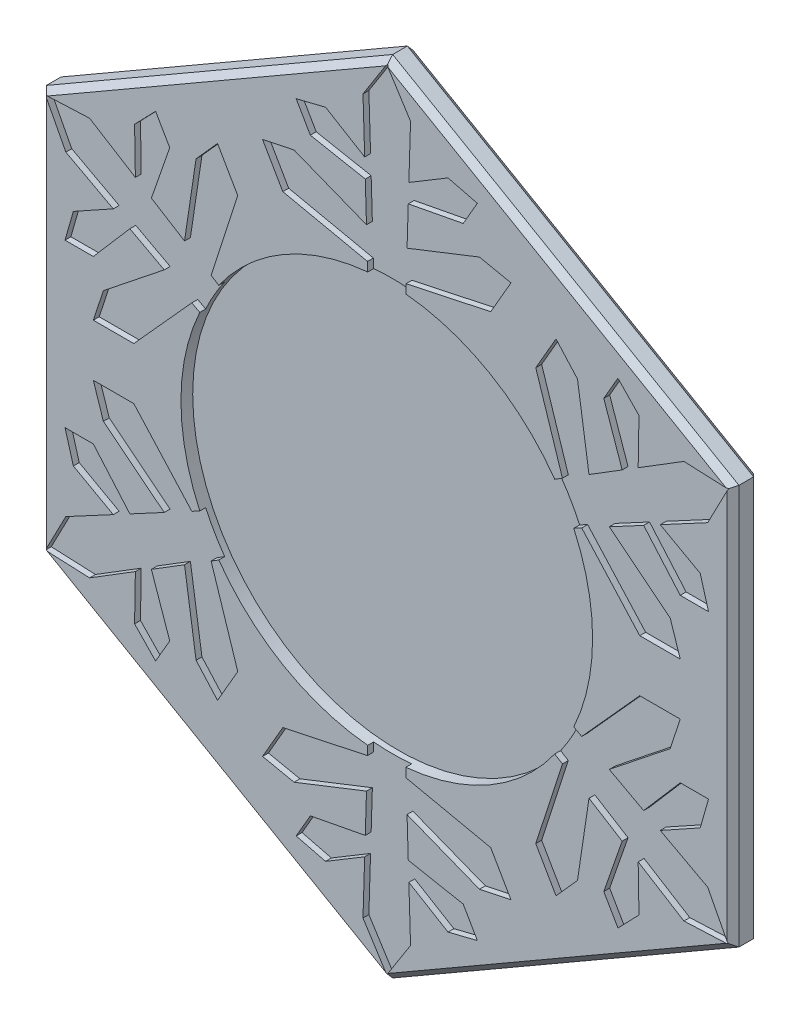
from build123d import *

# Parameters (mm, degrees)
EXTRUDE_1_DEPTH          = 5.5
CUT_EXTRUDE_8_DEPTH      = 1
SKETCH_7_R               = 37.5
CUT_EXTRUDE_9_DEPTH      = 1
SKETCH_8_R               = 35
CUT_EXTRUDE_10_DEPTH     = 2
CHAMFER_1_SIZE           = 1
CUT_EXTRUDE_START        = -2
SKETCH_10_R              = 35
CUT_EXTRUDE_11_DEPTH     = 2
EXTRUDE_START            = 1
EXTRUDE_2_DEPTH          = 1
PATTERN_CIRCULAR_1_COUNT = 6


with BuildPart() as part:
    # 스케치1 → 보스-돌출1 (new body)
    with BuildSketch(Plane.XY):
        Polygon((58.889727457, -34), (58.889727457, 34), (0, 68), (-58.889727457, 34), (-58.889727457, -34), (0, -68), align=None)
    extrude(amount=EXTRUDE_1_DEPTH)

    # 스케치6 → 컷-돌출8 (cut)
    with BuildSketch(Plane.XY.offset(5.5)):
        Polygon((-33.152687653, -15.35134242), (-27.3129803, -12.219678275), (-30.956617742, -8.576040833), (-32.161108524, -3.806551313), (-26.774618061, -3.806551313), (-23.390854065, -10.116356763), (-18.086111175, -7.271578403), (-19.979907887, -3.7401593), (-21.080522468, -5.792508073), (-24.19602311, -4.12175626), (-21.985645858, 0), (-24.19602311, 4.12175626), (-21.080522468, 5.792508073), (-19.979907887, 3.7401593), (-18.086111175, 7.271578403), (-23.390854065, 10.116356763), (-26.774618061, 3.806551313), (-32.161108524, 3.806551313), (-30.956617742, 8.576040833), (-27.3129803, 12.219678275), (-33.152687653, 15.35134242), (-43.016050627, 4.421097845), (-49.901643463, 4.421097845), (-48.193945113, 9.621970914), (-37.838156141, 17.864022042), (-43.683392033, 20.99865098), (-49.901643463, 13.801443509), (-54.714608607, 13.801443509), (-53.296688501, 18.748031205), (-46.506598426, 22.512653943), (-54.573925242, 26.838925211), (-58.05155344, 33.516080006), (-50.530153664, 33.842943038), (-42.749829434, 29.019568709), (-42.884615545, 36.782270577), (-39.309704991, 40.483519257), (-36.903222419, 36.315369176), (-40.027061211, 27.331601734), (-34.389774972, 23.836793429), (-32.429843803, 36.92619532), (-28.779604778, 41.005542007), (-25.33680836, 35.042443691), (-29.870996345, 21.035398501), (-24.239041963, 17.543895655), (-22.905378096, 22.521196964), (-19.3771244, 25.949061339), (-16.683879168, 21.284223761), (-20.456448983, 15.198895455), (-15.34042721, 12.027242531), (-13.229026912, 15.433028145), (-15.556720377, 15.360013946), (-15.667557184, 18.893492554), (-10.992822929, 19.040127831), (-8.528465926, 23.015248813), (-5.523802091, 21.152522019), (-6.750880975, 19.173187445), (-2.745683965, 19.298820935), (-2.934405082, 25.315252218), (-10.090738893, 25.090775074), (-12.783984124, 29.755612652), (-8.051239646, 31.097237797), (-3.073938337, 29.763573931), (-3.281691308, 36.386740922), (-17.679242267, 39.463541536), (-21.122038685, 45.426639853), (-15.764101311, 46.548166234), (-3.448381168, 41.700815471), (-3.656330822, 48.330252714), (-12.998421044, 50.116812684), (-15.404903616, 54.284962766), (-10.412072957, 55.530301782), (-3.756768991, 51.532222652), (-4.043771578, 60.681868249), (0, 67.032160011), (4.043771578, 60.681868249), (3.756768991, 51.532222652), (10.412072957, 55.530301782), (15.404903616, 54.284962766), (12.998421044, 50.116812684), (3.656330822, 48.330252714), (3.448381168, 41.700815471), (15.764101311, 46.548166234), (21.122038685, 45.426639853), (17.679242267, 39.463541536), (3.281691308, 36.386740922), (3.073938337, 29.763573931), (8.051239646, 31.097237797), (12.783984124, 29.755612652), (10.090738893, 25.090775074), (2.934405082, 25.315252218), (2.745683965, 19.298820935), (6.750880975, 19.173187445), (5.523802091, 21.152522019), (8.528465926, 23.015248813), (10.992822929, 19.040127831), (15.667557184, 18.893492554), (15.556720377, 15.360013946), (13.229026912, 15.433028145), (15.34042721, 12.027242531), (20.456448983, 15.198895455), (16.683879168, 21.284223761), (19.3771244, 25.949061339), (22.905378096, 22.521196964), (24.239041963, 17.543895655), (29.870996345, 21.035398501), (25.33680836, 35.042443691), (28.779604778, 41.005542007), (32.429843803, 36.92619532), (34.389774972, 23.836793429), (40.027061211, 27.331601734), (36.903222419, 36.315369176), (39.309704991, 40.483519257), (42.884615545, 36.782270577), (42.749829434, 29.019568709), (50.530153664, 33.842943038), (58.05155344, 33.516080006), (54.573925242, 26.838925211), (46.506598426, 22.512653943), (53.296688501, 18.748031205), (54.714608607, 13.801443509), (49.901643463, 13.801443509), (43.683392033, 20.99865098), (37.838156141, 17.864022042), (48.193945113, 9.621970914), (49.901643463, 4.421097845), (43.016050627, 4.421097845), (33.152687653, 15.35134242), (27.3129803, 12.219678275), (30.956617742, 8.576040833), (32.161108524, 3.806551313), (26.774618061, 3.806551313), (23.390854065, 10.116356763), (18.086111175, 7.271578403), (19.979907887, 3.7401593), (21.080522468, 5.792508073), (24.19602311, 4.12175626), (21.985645858, 0), (24.19602311, -4.12175626), (21.080522468, -5.792508073), (19.979907887, -3.7401593), (18.086111175, -7.271578403), (23.390854065, -10.116356763), (26.774618061, -3.806551313), (32.161108524, -3.806551313), (30.956617742, -8.576040833), (27.3129803, -12.219678275), (33.152687653, -15.35134242), (43.016050627, -4.421097845), (49.901643463, -4.421097845), (48.193945113, -9.621970914), (37.838156141, -17.864022042), (43.683392033, -20.99865098), (49.901643463, -13.801443509), (54.714608607, -13.801443509), (53.296688501, -18.748031205), (46.506598426, -22.512653943), (54.573925242, -26.838925211), (58.05155344, -33.516080006), (50.530153664, -33.842943038), (42.749829434, -29.019568709), (42.884615545, -36.782270577), (39.309704991, -40.483519257), (36.903222419, -36.315369176), (40.027061211, -27.331601734), (34.389774972, -23.836793429), (32.429843803, -36.92619532), (28.779604778, -41.005542007), (25.33680836, -35.042443691), (29.870996345, -21.035398501), (24.239041963, -17.543895655), (22.905378096, -22.521196964), (19.3771244, -25.949061339), (16.683879168, -21.284223761), (20.456448983, -15.198895455), (15.34042721, -12.027242531), (13.229026912, -15.433028145), (15.556720377, -15.360013946), (15.667557184, -18.893492554), (10.992822929, -19.040127831), (8.528465926, -23.015248813), (5.523802091, -21.152522019), (6.750880975, -19.173187445), (2.745683965, -19.298820935), (3.281691308, -36.386740922), (17.679242267, -39.463541536), (21.122038685, -45.426639853), (15.764101311, -46.548166234), (3.448381168, -41.700815471), (3.656330822, -48.330252714), (12.998421044, -50.116812684), (15.404903616, -54.284962766), (10.412072957, -55.530301782), (3.756768991, -51.532222652), (4.043771578, -60.681868249), (0, -67.032160011), (-4.043771578, -60.681868249), (-3.756768991, -51.532222652), (-10.412072957, -55.530301782), (-15.404903616, -54.284962766), (-12.998421044, -50.116812684), (-3.656330822, -48.330252714), (-3.448381168, -41.700815471), (-15.764101311, -46.548166234), (-21.122038685, -45.426639853), (-17.679242267, -39.463541536), (-3.281691308, -36.386740922), (-2.745683965, -19.298820935), (-6.750880975, -19.173187445), (-5.523802091, -21.152522019), (-8.528465926, -23.015248813), (-10.992822929, -19.040127831), (-15.667557184, -18.893492554), (-15.556720377, -15.360013946), (-13.229026912, -15.433028145), (-15.34042721, -12.027242531), (-20.456448983, -15.198895455), (-16.683879168, -21.284223761), (-19.3771244, -25.949061339), (-22.905378096, -22.521196964), (-24.239041963, -17.543895655), (-29.870996345, -21.035398501), (-25.33680836, -35.042443691), (-28.779604778, -41.005542007), (-32.429843803, -36.92619532), (-34.389774972, -23.836793429), (-40.027061211, -27.331601734), (-36.903222419, -36.315369176), (-39.309704991, -40.483519257), (-42.884615545, -36.782270577), (-42.749829434, -29.019568709), (-50.530153664, -33.842943038), (-58.05155344, -33.516080006), (-54.573925242, -26.838925211), (-46.506598426, -22.512653943), (-53.296688501, -18.748031205), (-54.714608607, -13.801443509), (-49.901643463, -13.801443509), (-43.683392033, -20.99865098), (-37.838156141, -17.864022042), (-48.193945113, -9.621970914), (-49.901643463, -4.421097845), (-43.016050627, -4.421097845), align=None)
        Polygon((-11.624772014, -3.806551313), (-14.970610533, 0), (-11.624772014, 3.806551313), (-14.970610533, 5.600826589), (-17.974169916, 0), (-14.970610533, -5.600826589), align=None, mode=Mode.SUBTRACT)
        Polygon((8.987084958, -15.566087759), (12.335763375, -10.164515737), (9.108956144, -8.164072221), (7.485305267, -12.964929032), (2.515815869, -11.970623533), (2.634847158, -15.765342327), align=None, mode=Mode.SUBTRACT)
        with BuildLine():
            Line((-12.195196565, 0), (-9.738486924, -2.794991825))
            Line((-9.738486924, -2.794991825), (-5.95116479, -0.763961806))
            ThreePointArc((-5.95116479, -0.763961806), (-6, 0), (-5.95116479, 0.763961806))
            Line((-5.95116479, 0.763961806), (-9.738486924, 2.794991825))
            Line((-9.738486924, 2.794991825), (-12.195196565, 0))
        make_face(mode=Mode.SUBTRACT)
        with BuildLine():
            Line((-6.097598283, -10.56135003), (-7.289777385, -7.036281158))
            Line((-7.289777385, -7.036281158), (-3.637192727, -4.771878987))
            ThreePointArc((-3.637192727, -4.771878987), (-3, -5.196152423), (-2.313972063, -5.535840793))
            Line((-2.313972063, -5.535840793), (-2.448709539, -9.831272983))
            Line((-2.448709539, -9.831272983), (-6.097598283, -10.56135003))
        make_face(mode=Mode.SUBTRACT)
        Polygon((-9.108956144, -8.164072221), (-7.485305267, -12.964929032), (-2.515815869, -11.970623533), (-2.634847158, -15.765342327), (-8.987084958, -15.566087759), (-12.335763375, -10.164515737), align=None, mode=Mode.SUBTRACT)
        Polygon((-9.108956144, 8.164072221), (-7.485305267, 12.964929032), (-2.515815869, 11.970623533), (-2.634847158, 15.765342327), (-8.987084958, 15.566087759), (-12.335763375, 10.164515737), align=None, mode=Mode.SUBTRACT)
        with BuildLine():
            Line((-6.097598283, 10.56135003), (-7.289777385, 7.036281158))
            Line((-7.289777385, 7.036281158), (-3.637192727, 4.771878987))
            ThreePointArc((-3.637192727, 4.771878987), (-3, 5.196152423), (-2.313972063, 5.535840793))
            Line((-2.313972063, 5.535840793), (-2.448709539, 9.831272983))
            Line((-2.448709539, 9.831272983), (-6.097598283, 10.56135003))
        make_face(mode=Mode.SUBTRACT)
        Polygon((2.515815869, 11.970623533), (7.485305267, 12.964929032), (9.108956144, 8.164072221), (12.335763375, 10.164515737), (8.987084958, 15.566087759), (2.634847158, 15.765342327), align=None, mode=Mode.SUBTRACT)
        with BuildLine():
            Line((6.097598283, 10.56135003), (2.448709539, 9.831272983))
            Line((2.448709539, 9.831272983), (2.313972063, 5.535840793))
            ThreePointArc((2.313972063, 5.535840793), (3, 5.196152423), (3.637192727, 4.771878987))
            Line((3.637192727, 4.771878987), (7.289777385, 7.036281158))
            Line((7.289777385, 7.036281158), (6.097598283, 10.56135003))
        make_face(mode=Mode.SUBTRACT)
        Polygon((11.624772014, 3.806551313), (14.970610533, 0), (11.624772014, -3.806551313), (14.970610533, -5.600826589), (17.974169916, 0), (14.970610533, 5.600826589), align=None, mode=Mode.SUBTRACT)
        with BuildLine():
            Line((12.195196565, 0), (9.738486924, 2.794991825))
            Line((9.738486924, 2.794991825), (5.95116479, 0.763961806))
            ThreePointArc((5.95116479, 0.763961806), (6, 0), (5.95116479, -0.763961806))
            Line((5.95116479, -0.763961806), (9.738486924, -2.794991825))
            Line((9.738486924, -2.794991825), (12.195196565, 0))
        make_face(mode=Mode.SUBTRACT)
        with BuildLine():
            Line((6.097598283, -10.56135003), (7.289777385, -7.036281158))
            Line((7.289777385, -7.036281158), (3.637192727, -4.771878987))
            ThreePointArc((3.637192727, -4.771878987), (3, -5.196152423), (2.313972063, -5.535840793))
            Line((2.313972063, -5.535840793), (2.448709539, -9.831272983))
            Line((2.448709539, -9.831272983), (6.097598283, -10.56135003))
        make_face(mode=Mode.SUBTRACT)
    extrude(amount=-CUT_EXTRUDE_8_DEPTH, mode=Mode.SUBTRACT)

    # 스케치7 → 컷-돌출9 (cut)
    with BuildSketch(Plane(origin=(0, 0, 0), x_dir=(-1, 0, 0), z_dir=(0, 0, -1))):
        Polygon((0, 68), (-58.889727457, 34), (-58.889727457, -34), (0, -68), (58.889727457, -34), (58.889727457, 34), align=None)
        Circle(SKETCH_7_R, mode=Mode.SUBTRACT)
    extrude(amount=-CUT_EXTRUDE_9_DEPTH, mode=Mode.SUBTRACT)

    # 스케치8 → 컷-돌출10 (cut)
    with BuildSketch(Plane(origin=(0, 0, 0), x_dir=(-1, 0, 0), z_dir=(0, 0, -1))):
        Circle(SKETCH_8_R)
    extrude(amount=-CUT_EXTRUDE_10_DEPTH, mode=Mode.SUBTRACT)

    # 모따기1
    # the kernel refuses this chamfer: 1 mm, written as the material it takes off along each edge
    with BuildSketch(Plane(origin=(-61.116870255, -32.714158506, 5.5), x_dir=(0.4998109584556484, 0.8656979742248804, 0.027495876610586535), z_dir=(0.8660254037844387, -0.5, 0)), Plane(origin=(-2.227142798, -69.285841494, 5.5), x_dir=(-0.4998109584556484, 0.8656979742248804, 0.02749587661058667), z_dir=(0.8660254037844387, 0.5, 0)), Plane(origin=(2.227142798, 69.285841494, 5.5), x_dir=(0.4998109584556484, -0.8656979742248804, 0.02749587661058667), z_dir=(-0.8660254037844386, -0.4999999999999999, 0)), Plane(origin=(-58.889727457, 36.571682988, 5.5), x_dir=(0.9996219169112968, 0, 0.027495876610586414), z_dir=(0, -1, 0)), Plane(origin=(-58.889727457, -36.571682988, 1), x_dir=(0.9996219169112968, 0, -0.027495876610586306), z_dir=(0, 1, 0)), Plane(origin=(2.227142798, -69.285841494, 1), x_dir=(0.4998109584556484, 0.8656979742248804, -0.027495876610586563), z_dir=(-0.8660254037844387, 0.5, 0)), Plane(origin=(61.116870255, -32.714158506, 1), x_dir=(-0.4998109584556484, 0.8656979742248804, -0.027495876610586424), z_dir=(-0.8660254037844387, -0.5, 0)), Plane(origin=(-2.227142798, 69.285841494, 1), x_dir=(-0.49981095845564816, -0.8656979742248805, -0.02749587661058657), z_dir=(0.8660254037844388, -0.4999999999999998, 0)), Plane(origin=(-61.116870255, 32.714158506, 1), x_dir=(0.4998109584556484, -0.8656979742248805, -0.027495876610586324), z_dir=(0.8660254037844386, 0.4999999999999999, 0))) as chamfer_1_piece_1:
        Polygon((CHAMFER_1_SIZE * 0.999621916911, -CHAMFER_1_SIZE * 0.0274958766106), (-CHAMFER_1_SIZE * 0.0274958766106, -CHAMFER_1_SIZE * 0.999621916911), (0, 0), align=None)
    extrude(amount=73.143365976, mode=Mode.SUBTRACT)
    with BuildSketch(Plane(origin=(58.889727457, -36.571682988, 5.5), x_dir=(0.02749587661058907, 0, -0.9996219169112965), z_dir=(0, 1, 0)), Plane(origin=(61.116870255, 32.714158506, 5.5), x_dir=(0.01374793830529137, 0.023812127644087033, -0.9996219169112968), z_dir=(-0.8660254037844388, 0.4999999999999998, 0)), Plane(origin=(58.889727457, 36.571682988, 1), x_dir=(0.02749587661058907, 0, 0.9996219169112965), z_dir=(0, -1, 0))) as chamfer_1_piece_2:
        Polygon((CHAMFER_1_SIZE * 0.999621916911, CHAMFER_1_SIZE * 0.0274958766106), (-CHAMFER_1_SIZE * 0.0274958766106, CHAMFER_1_SIZE * 0.999621916911), (0, 0), align=None)
    extrude(amount=73.143365976, mode=Mode.SUBTRACT)

    # 스케치10 → 컷-돌출11 (cut)
    with BuildSketch(Plane.XY.offset(5.5).offset(CUT_EXTRUDE_START)):
        with Locations(Location((0, 0, 0), (0, 0, 180))):
            Circle(SKETCH_10_R)
    extrude(amount=CUT_EXTRUDE_11_DEPTH, mode=Mode.SUBTRACT)

    # 스케치11 → 보스-돌출2 (add)
    with BuildSketch(Plane(origin=(0, 0, 1), x_dir=(-1, 0, 0), z_dir=(0, 0, -1)).offset(EXTRUDE_START)):
        with BuildLine():
            Line((-40.62782027, -7.748563452), (-37.067262269, -5.680498912))
            ThreePointArc((-37.067262269, -5.680498912), (-37.241248352, -4.397660877), (-37.370850955, -3.109581786))
            Line((-37.370850955, -3.109581786), (-40.62782027, -4.787526931))
            Line((-40.62782027, -4.787526931), (-46.584297818, 0))
            Line((-46.584297818, 0), (-40.62782027, 4.787526931))
            Line((-40.62782027, 4.787526931), (-37.370850955, 3.109581786))
            ThreePointArc((-37.370850955, 3.109581786), (-37.241248352, 4.397660877), (-37.067262269, 5.680498912))
            Line((-37.067262269, 5.680498912), (-40.62782027, 7.748563452))
            Line((-40.62782027, 7.748563452), (-50.213714892, 0))
            Line((-50.213714892, 0), (-40.62782027, -7.748563452))
        make_face()
        with BuildLine():
            Line((-40.412337515, -2.194596557), (-37.478942652, -1.256526036))
            ThreePointArc((-37.478942652, -1.256526036), (-37.5, 0), (-37.478942652, 1.256526036))
            Line((-37.478942652, 1.256526036), (-40.412337515, 2.194596557))
            Line((-40.412337515, 2.194596557), (-42.878014066, 0))
            Line((-42.878014066, 0), (-40.412337515, -2.194596557))
        make_face()
        with BuildLine():
            Line((-54.436281692, -22.923004064), (-51.910154867, -24.167145636))
            Line((-51.910154867, -24.167145636), (-51.910154867, -26.38839624))
            Line((-51.910154867, -26.38839624), (-55.548949831, -28.957161403))
            Line((-55.548949831, -28.957161403), (-55.548949831, -32.071201138))
            Line((-55.548949831, -32.071201138), (-52.852112312, -33.628221006))
            Line((-52.852112312, -33.628221006), (-48.808098943, -31.761314709))
            Line((-48.808098943, -31.761314709), (-46.884439491, -32.871940011))
            Line((-46.884439491, -32.871940011), (-47.070044697, -35.681700801))
            Line((-47.070044697, -35.681700801), (-42.285529285, -38.444042062))
            Line((-42.285529285, -38.444042062), (-41.735251601, -30.113733361))
            Line((-41.735251601, -30.113733361), (-36.786801098, -27.588253914))
            Line((-36.786801098, -27.588253914), (-37.628366754, -40.328188515))
            Line((-37.628366754, -40.328188515), (-33.580162352, -42.665420416))
            Line((-33.580162352, -42.665420416), (-32.750232927, -24.335475534))
            Line((-32.750232927, -24.335475534), (-30.09993265, -22.366136333))
            ThreePointArc((-30.09993265, -22.366136333), (-30.484686378, -21.838816278), (-30.86020307, -21.304878936))
            Line((-30.86020307, -21.304878936), (-33.446421411, -23.090319834))
            Line((-33.446421411, -23.090319834), (-34.729232594, -39.889751985))
            Line((-34.729232594, -39.889751985), (-36.289193306, -38.989108249))
            Line((-36.289193306, -38.989108249), (-35.12928317, -23.799163003))
            Line((-35.12928317, -23.799163003), (-43.061914099, -28.929106074))
            Line((-43.061914099, -28.929106074), (-43.589392841, -36.110897343))
            Line((-43.589392841, -36.110897343), (-45.190954508, -35.186235284))
            Line((-45.190954508, -35.186235284), (-44.958761297, -32.024850683))
            Line((-44.958761297, -32.024850683), (-48.921134828, -29.737173258))
            Line((-48.921134828, -29.737173258), (-52.392102497, -31.80434171))
            Line((-52.392102497, -31.80434171), (-53.73941912, -31.026468095))
            Line((-53.73941912, -31.026468095), (-53.73941912, -29.470720865))
            Line((-53.73941912, -29.470720865), (-50.213714892, -27.498358914))
            Line((-50.213714892, -27.498358914), (-50.213714892, -22.923004064))
            Line((-50.213714892, -22.923004064), (-53.067650873, -21.543396983))
            Line((-53.067650873, -21.543396983), (-53.067650873, -19.694072865))
            Line((-53.067650873, -19.694072865), (-46.584297818, -22.828158509))
            Line((-46.584297818, -22.828158509), (-38.175321334, -18.52327014))
            Line((-38.175321334, -18.52327014), (-51.910154867, -11.932809161))
            Line((-51.910154867, -11.932809161), (-51.910154867, -10.131521688))
            Line((-51.910154867, -10.131521688), (-36.720014263, -17.420290691))
            Line((-36.720014263, -17.420290691), (-33.880667918, -16.073280356))
            ThreePointArc((-33.880667918, -16.073280356), (-34.155312875, -15.481104691), (-34.419608574, -14.884238161))
            Line((-34.419608574, -14.884238161), (-37.450256489, -16.194795928))
            Line((-37.450256489, -16.194795928), (-53.73941912, -7.748563452))
            Line((-53.73941912, -7.748563452), (-53.73941912, -12.423027254))
            Line((-53.73941912, -12.423027254), (-42.285529285, -18.064177317))
            Line((-42.285529285, -18.064177317), (-46.946883894, -21.086921439))
            Line((-46.946883894, -21.086921439), (-54.436281692, -17.398321542))
            Line((-54.436281692, -17.398321542), (-54.436281692, -22.923004064))
        make_face()
        with BuildLine():
            ThreePointArc((-31.757347071, -19.942941284), (-32.475952642, -18.75), (-33.149767313, -17.531198678))
            Line((-33.149767313, -17.531198678), (-45.697688399, -24.167145636))
            Line((-45.697688399, -24.167145636), (-47.628554764, -24.167145636))
            Line((-47.628554764, -24.167145636), (-47.628554764, -27.498358914))
            Line((-47.628554764, -27.498358914), (-44.74363944, -29.163965553))
            Line((-44.74363944, -29.163965553), (-43.778206257, -27.49178623))
            Line((-43.778206257, -27.49178623), (-31.757347071, -19.942941284))
        make_face()
    extrude_2 = extrude(amount=-EXTRUDE_2_DEPTH)

    # 원형 패턴1: 보스-돌출2 ×6 about axis
    pattern_circular_1_axis = Axis((0, 0, 0), (0, 0, 1))
    for i in range(1, PATTERN_CIRCULAR_1_COUNT):
        add(extrude_2.rotate(pattern_circular_1_axis, i * 360 / PATTERN_CIRCULAR_1_COUNT))


solid = part.part
